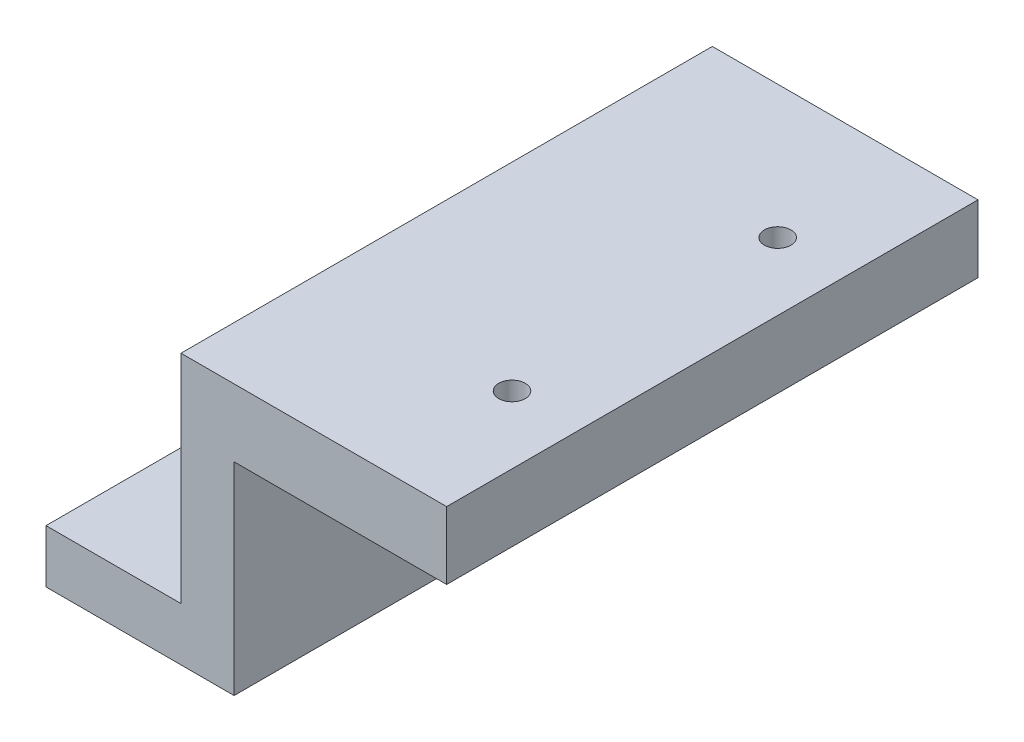
from build123d import *

# Parameters (mm, degrees)
SKETCH1_W             = 50
SKETCH1_H             = 12.7
BOSS_EXTRUDE1_DEPTH   = 100
SKETCH2_W             = 10
SKETCH2_H             = 100
BOSS_EXTRUDE2_DEPTH   = 38.1
SKETCH3_W             = 100
SKETCH3_H             = 10
BOSS_EXTRUDE3_DEPTH   = 25.4
M5X0_8_TAPPED_HOLE1_D = 5
M5X0_8_TAPPED_HOLE2_D = 5


with BuildPart() as part:
    # Sketch1 → Boss-Extrude1 (new body)
    with BuildSketch(Plane.XY):
        Rectangle(SKETCH1_W, SKETCH1_H)
    extrude(amount=BOSS_EXTRUDE1_DEPTH)

    # Sketch2 → Boss-Extrude2 (add)
    with BuildSketch(Plane.XZ.offset(6.35)):
        with Locations((-20, 50)):
            Rectangle(SKETCH2_W, SKETCH2_H)
    extrude(amount=BOSS_EXTRUDE2_DEPTH)

    # Sketch3 → Boss-Extrude3 (add)
    with BuildSketch(Plane.ZY.offset(25)):
        with Locations((50, -39.45)):
            Rectangle(SKETCH3_W, SKETCH3_H)
    extrude(amount=BOSS_EXTRUDE3_DEPTH)

    # M5x0.8 Tapped Hole1 (through all)
    with Locations(Plane(origin=(0, 6.35, 0), x_dir=(1, 0, 0), z_dir=(0, 1, 0))):
        with Locations((12.3, -75), (12.3, -25)):
            Hole(M5X0_8_TAPPED_HOLE1_D / 2)

    # M5x0.8 Tapped Hole2 (through all)
    with Locations(Plane(origin=(-15, 0, 0), x_dir=(0, 0, -1), z_dir=(1, 0, 0))):
        with Locations((-27, -9.45), (-73, -27.45), (-27, -27.45), (-73, -9.45)):
            Hole(M5X0_8_TAPPED_HOLE2_D / 2)


solid = part.part
